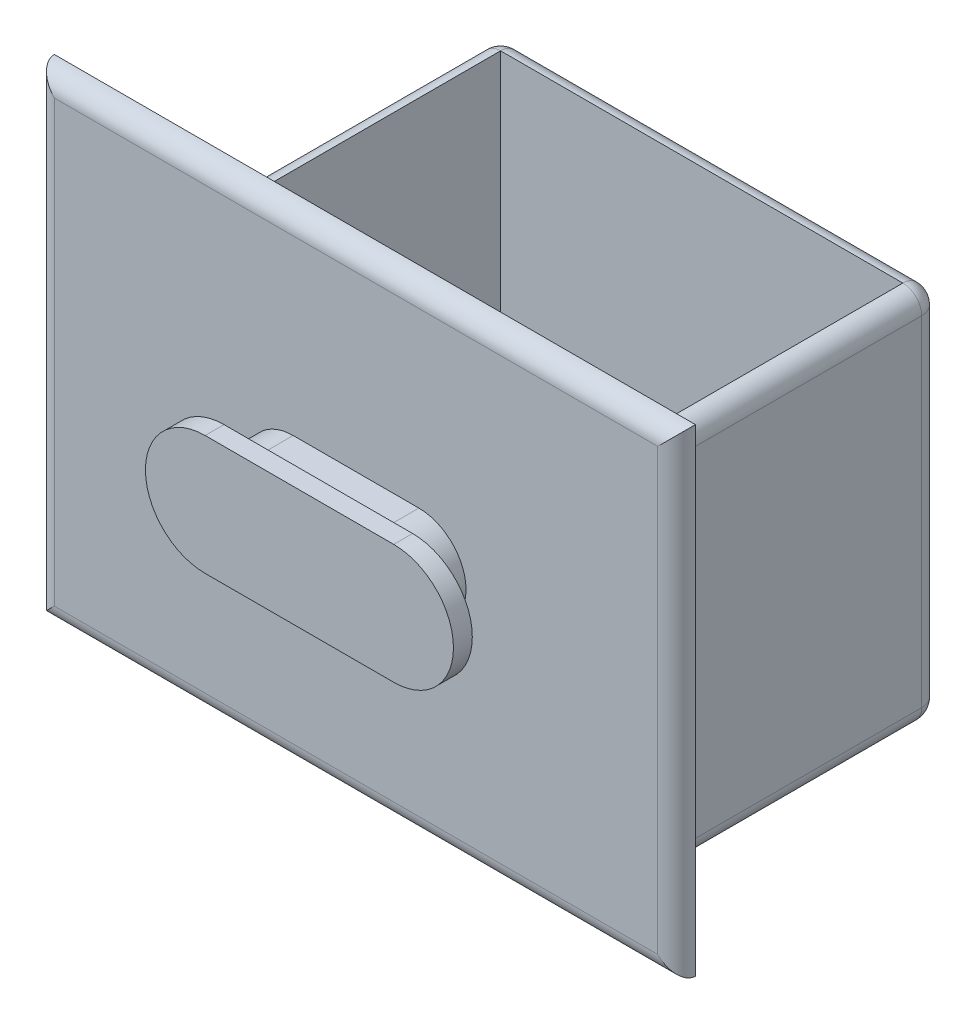
from build123d import *

# Parameters (mm, degrees)
SKETCH_1_W      = 70
SKETCH_1_H      = 60
EXTRUDE_1_DEPTH = 55
SHELL_1_T       = -3
SKETCH_2_W      = 102
SKETCH_2_H      = 76
EXTRUDE_2_DEPTH = 3
FILLET_1_R      = 3
FILLET_4_R      = 3
EXTRUDE_3_DEPTH = 6
EXTRUDE_4_DEPTH = 3


with BuildPart() as part:
    # 草图1 → 凸台-拉伸1 (new body)
    with BuildSketch(Plane.XY):
        Rectangle(SKETCH_1_W, SKETCH_1_H)
    extrude(amount=EXTRUDE_1_DEPTH)

    # 抽壳1
    shell_1_openings = [part.faces().sort_by_distance(p)[0] for p in [
        (0, 30, 27.5),
    ]]
    offset(amount=SHELL_1_T, openings=shell_1_openings, kind=Kind.INTERSECTION)

    # 草图2 → 凸台-拉伸2 (add)
    with BuildSketch(Plane.XY.offset(55)):
        with Locations((0, 8)):
            Rectangle(SKETCH_2_W, SKETCH_2_H)
    extrude(amount=EXTRUDE_2_DEPTH)

    # 圆角1
    fillet_1_edges = [part.edges().sort_by_distance(p)[0] for p in [
        (0, 46, 58),
        (51, 8, 58),
        (0, -30, 58),
        (-51, 8, 58),
    ]]
    fillet(fillet_1_edges, radius=FILLET_1_R - 0.0001)  # a hair under: the kernel refuses the full size

    # 圆角4
    fillet_4_edges = [part.edges().sort_by_distance(p)[0] for p in [
        (0, -30, 0),
        (-35, 0, 0),
        (0, 30, 0),
        (35, 0, 0),
        (35, -30, 27.5),
        (-35, -30, 27.5),
        (-35, 30, 27.5),
        (35, 30, 27.5),
    ]]
    fillet(fillet_4_edges, radius=FILLET_4_R - 0.0001)  # a hair under: the kernel refuses the full size

    # 草图3 → 凸台-拉伸3 (add)
    with BuildSketch(Plane.XY.offset(58)):
        with BuildLine():
            Line((-10, 15.5), (10, 15.5))
            ThreePointArc((10, 15.5), (17.5, 8), (10, 0.5))
            Line((10, 0.5), (-10, 0.5))
            ThreePointArc((-10, 0.5), (-17.5, 8), (-10, 15.5))
        make_face()
    extrude(amount=EXTRUDE_3_DEPTH)

    # 草图4 → 凸台-拉伸4 (add)
    with BuildSketch(Plane.XY.offset(64)):
        with BuildLine():
            Line((-15, 17.5), (15, 17.5))
            ThreePointArc((15, 17.5), (24.5, 8), (15, -1.5))
            Line((15, -1.5), (-15, -1.5))
            ThreePointArc((-15, -1.5), (-24.5, 8), (-15, 17.5))
        make_face()
    extrude(amount=EXTRUDE_4_DEPTH)


solid = part.part
